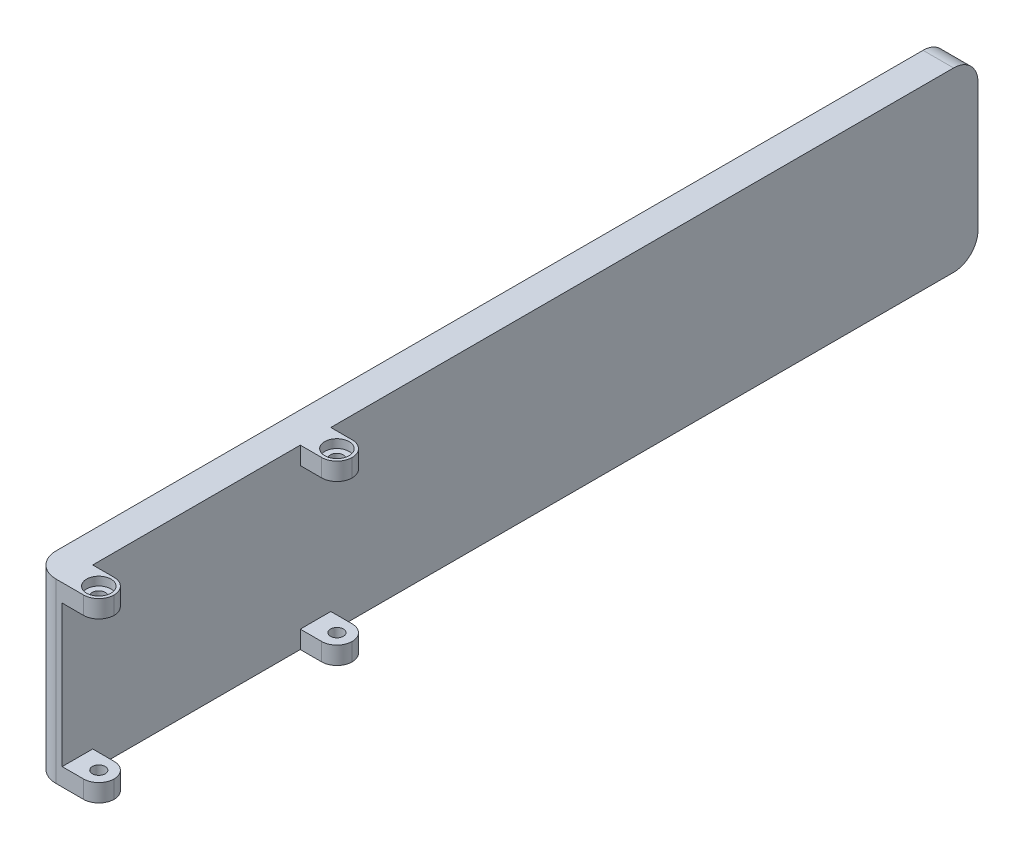
from build123d import *

# Parameters (mm, degrees)
SKETCH1_W           = 5
SKETCH1_H           = 150
BOSS_EXTRUDE1_DEPTH = 29
SKETCH2_W           = 5
SKETCH2_H           = 2.9
BOSS_EXTRUDE2_DEPTH = 6
SKETCH3_R           = 1.05
CUT_EXTRUDE1_DEPTH  = 153.895389074
SKETCH4_R           = 2
CUT_EXTRUDE2_DEPTH  = 1.4
FILLET1_R           = 4
FILLET2_R           = 2.5


with BuildPart() as part:
    # Sketch1 → Boss-Extrude1 (new body)
    with BuildSketch(Plane(origin=(0, 0, 0), x_dir=(1, 0, 0), z_dir=(0, 1, 0))):
        with Locations((-2.5, 75)):
            Rectangle(SKETCH1_W, SKETCH1_H)
    extrude(amount=BOSS_EXTRUDE1_DEPTH)

    # Sketch2 → Boss-Extrude2 (add)
    with BuildSketch(Plane(origin=(0, 0, 0), x_dir=(0, 0, -1), z_dir=(1, 0, 0))):
        with Locations((2.5, 27.55)):
            Rectangle(SKETCH2_W, SKETCH2_H)
        with Locations((41.5, 27.55)):
            Rectangle(SKETCH2_W, SKETCH2_H)
        with Locations((41.5, 1.45)):
            Rectangle(SKETCH2_W, SKETCH2_H)
        with Locations((2.5, 1.45)):
            Rectangle(SKETCH2_W, SKETCH2_H)
    extrude(amount=BOSS_EXTRUDE2_DEPTH)

    # Sketch3 → Cut-Extrude1 (cut, through all)
    with BuildSketch(Plane(origin=(0, 29, 0), x_dir=(1, 0, 0), z_dir=(0, 1, 0))):
        with Locations(Location((3.5, 41.5, 0), (0, 0, 270))):
            Circle(SKETCH3_R)
        with Locations(Location((3.5, 2.5, 0), (0, 0, 270))):
            Circle(SKETCH3_R)
    extrude(amount=-CUT_EXTRUDE1_DEPTH, mode=Mode.SUBTRACT)

    # Sketch4 → Cut-Extrude2 (cut)
    with BuildSketch(Plane(origin=(0, 29, 0), x_dir=(1, 0, 0), z_dir=(0, 1, 0))):
        with Locations(Location((3.5, 41.5, 0), (0, 0, 270))):
            Circle(SKETCH4_R)
        with Locations(Location((3.5, 2.5, 0), (0, 0, 270))):
            Circle(SKETCH4_R)
    cut_extrude2 = extrude(amount=-CUT_EXTRUDE2_DEPTH, mode=Mode.SUBTRACT)

    # Mirror2: Cut-Extrude2 across plane
    add(cut_extrude2.mirror(Plane.ZX.offset(14.5)), mode=Mode.SUBTRACT)

    # Fillet1
    fillet1_edges = [part.edges().sort_by_distance(p)[0] for p in [
        (-2.5, 0, -150),
        (-5, 14.5, 0),
        (-2.5, 29, -150),
    ]]
    fillet(fillet1_edges, radius=FILLET1_R)

    # Fillet2
    fillet2_edges = [part.edges().sort_by_distance(p)[0] for p in [
        (6, 1.45, -5),
        (6, 1.45, 0),
        (6, 1.45, -44),
        (6, 1.45, -39),
        (6, 27.55, -44),
        (6, 27.55, -39),
        (6, 27.55, -5),
        (6, 27.55, 0),
    ]]
    fillet(fillet2_edges, radius=FILLET2_R - 0.0001)  # a hair under: the kernel refuses the full size


solid = part.part
